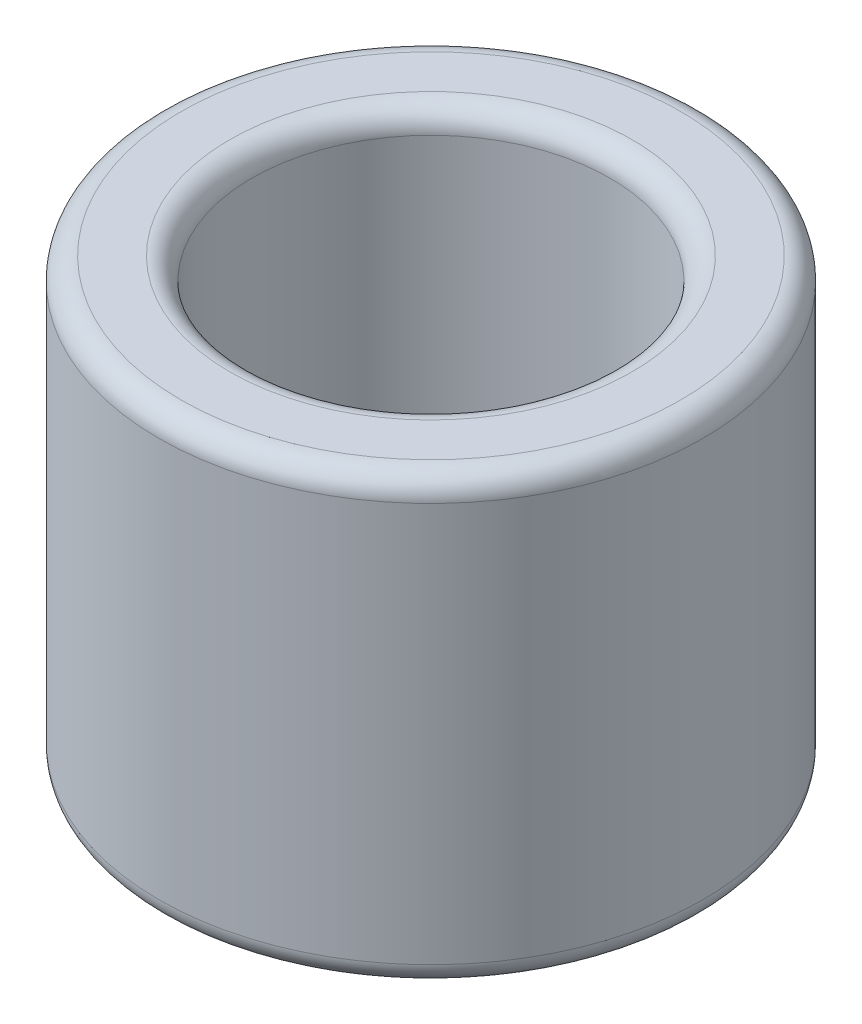
from build123d import *

# Parameters (mm, degrees)
SKETCH2_R    = 4.826
SKETCH2_R_2  = 3.175
SPACER_DEPTH = 7.874
FILLET_2_R   = 0.3937


with BuildPart() as part:
    # Sketch2 → Spacer (new body)
    with BuildSketch(Plane(origin=(0, 0, 0), x_dir=(1, 0, 0), z_dir=(0, 1, 0))):
        Circle(SKETCH2_R)
        Circle(SKETCH2_R_2, mode=Mode.SUBTRACT)
    extrude(amount=SPACER_DEPTH)

    # Fillet 2
    fillet_2_edges = [part.edges().sort_by_distance(p)[0] for p in [
        (-3.175, 0, 0),
        (-4.826, 0, 0),
        (-3.175, 7.874, 0),
        (-4.826, 7.874, 0),
    ]]
    fillet(fillet_2_edges, radius=FILLET_2_R)


solid = part.part
